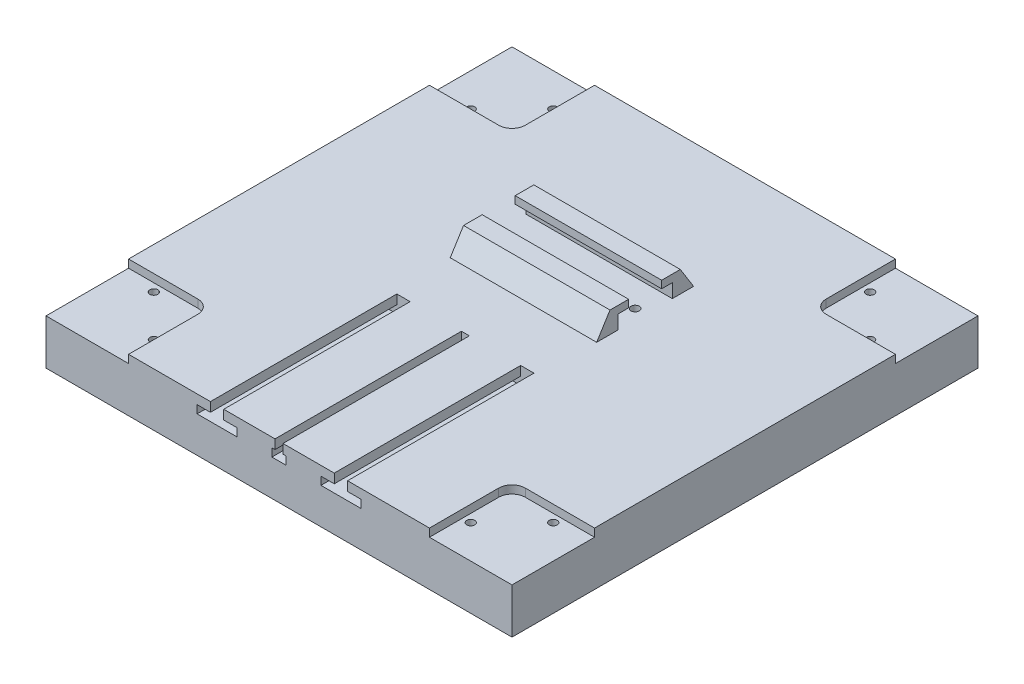
from build123d import *

# Parameters (mm, degrees)
SKETCH1_W           = 175
SKETCH1_H           = 175
BOSS_EXTRUDE2_DEPTH = 20
CUT_EXTRUDE6_DEPTH  = 3
CUT_EXTRUDE7_REACH  = 126.906
SKETCH8_R           = 1.5
CUT_EXTRUDE8_DEPTH  = 70
CUT_EXTRUDE9_REACH  = 127.35
SKETCH10_R          = 1.55
BOSS_EXTRUDE4_START = 8
SKETCH11_W          = 55
SKETCH11_H          = 26.4
SKETCH11_R          = 1.55
BOSS_EXTRUDE4_DEPTH = 8
CUT_EXTRUDE10_REACH = 149.191
SKETCH14_W          = 20.4
SKETCH14_H          = 5.2
CUT_EXTRUDE11_REACH = 149.191
SKETCH15_W          = 12.4
SKETCH15_H          = 2.8
BOSS_EXTRUDE7_DEPTH = 55
BOSS_EXTRUDE8_DEPTH = 55


with BuildPart() as part:
    # Sketch1 → Boss-Extrude2 (new body)
    with BuildSketch(Plane(origin=(0, 0, 0), x_dir=(1, 0, 0), z_dir=(0, 1, 0))):
        Rectangle(SKETCH1_W, SKETCH1_H)
    extrude(amount=BOSS_EXTRUDE2_DEPTH)

    # Sketch7 → Cut-Extrude6 (cut)
    with BuildSketch(Plane(origin=(0, 20, 0), x_dir=(1, 0, 0), z_dir=(0, 1, 0))):
        with BuildLine():
            Line((-87.5, 87.5), (-56.5, 87.5))
            Line((-56.5, 87.5), (-56.5, 61.5))
            ThreePointArc((-56.5, 61.5), (-57.964466094, 57.964466094), (-61.5, 56.5))
            Line((-61.5, 56.5), (-87.5, 56.5))
            Line((-87.5, 56.5), (-87.5, 87.5))
        make_face()
        with BuildLine():
            Line((87.5, 56.5), (61.5, 56.5))
            ThreePointArc((61.5, 56.5), (57.964466094, 57.964466094), (56.5, 61.5))
            Line((56.5, 61.5), (56.5, 87.5))
            Line((56.5, 87.5), (87.5, 87.5))
            Line((87.5, 87.5), (87.5, 56.5))
        make_face()
        with BuildLine():
            Line((87.5, -87.5), (87.5, -56.5))
            Line((87.5, -56.5), (61.5, -56.5))
            ThreePointArc((61.5, -56.5), (57.964466094, -57.964466094), (56.5, -61.5))
            Line((56.5, -61.5), (56.5, -87.5))
            Line((56.5, -87.5), (87.5, -87.5))
        make_face()
        with BuildLine():
            Line((-56.5, -87.5), (-56.5, -61.5))
            ThreePointArc((-56.5, -61.5), (-57.964466094, -57.964466094), (-61.5, -56.5))
            Line((-61.5, -56.5), (-87.5, -56.5))
            Line((-87.5, -56.5), (-87.5, -87.5))
            Line((-87.5, -87.5), (-56.5, -87.5))
        make_face()
    extrude(amount=-CUT_EXTRUDE6_DEPTH, mode=Mode.SUBTRACT)

    # Sketch8 → Cut-Extrude7 (cut, up to next)
    with BuildSketch(Plane(origin=(0, 17, 0), x_dir=(1, 0, 0), z_dir=(0, 1, 0)), mode=Mode.PRIVATE) as cut_extrude7_sk1:
        with Locations((-75, -59.5)):
            Circle(SKETCH8_R)
    cut_extrude7_tool1 = extrude(cut_extrude7_sk1.sketch, amount=-CUT_EXTRUDE7_REACH, mode=Mode.PRIVATE) & part.part
    # Sketch8 → Cut-Extrude7 (cut, up to next)
    with BuildSketch(Plane(origin=(0, 17, 0), x_dir=(1, 0, 0), z_dir=(0, 1, 0)), mode=Mode.PRIVATE) as cut_extrude7_sk2:
        with Locations((-59.5, -75)):
            Circle(SKETCH8_R)
    cut_extrude7_tool2 = extrude(cut_extrude7_sk2.sketch, amount=-CUT_EXTRUDE7_REACH, mode=Mode.PRIVATE) & part.part
    # Sketch8 → Cut-Extrude7 (cut, up to next)
    with BuildSketch(Plane(origin=(0, 17, 0), x_dir=(1, 0, 0), z_dir=(0, 1, 0)), mode=Mode.PRIVATE) as cut_extrude7_sk3:
        with Locations((59.5, -75)):
            Circle(SKETCH8_R)
    cut_extrude7_tool3 = extrude(cut_extrude7_sk3.sketch, amount=-CUT_EXTRUDE7_REACH, mode=Mode.PRIVATE) & part.part
    # Sketch8 → Cut-Extrude7 (cut, up to next)
    with BuildSketch(Plane(origin=(0, 17, 0), x_dir=(1, 0, 0), z_dir=(0, 1, 0)), mode=Mode.PRIVATE) as cut_extrude7_sk4:
        with Locations((75, -59.5)):
            Circle(SKETCH8_R)
    cut_extrude7_tool4 = extrude(cut_extrude7_sk4.sketch, amount=-CUT_EXTRUDE7_REACH, mode=Mode.PRIVATE) & part.part
    # Sketch8 → Cut-Extrude7 (cut, up to next)
    with BuildSketch(Plane(origin=(0, 17, 0), x_dir=(1, 0, 0), z_dir=(0, 1, 0)), mode=Mode.PRIVATE) as cut_extrude7_sk5:
        with Locations((59.5, 75)):
            Circle(SKETCH8_R)
    cut_extrude7_tool5 = extrude(cut_extrude7_sk5.sketch, amount=-CUT_EXTRUDE7_REACH, mode=Mode.PRIVATE) & part.part
    # Sketch8 → Cut-Extrude7 (cut, up to next)
    with BuildSketch(Plane(origin=(0, 17, 0), x_dir=(1, 0, 0), z_dir=(0, 1, 0)), mode=Mode.PRIVATE) as cut_extrude7_sk6:
        with Locations((75, 59.5)):
            Circle(SKETCH8_R)
    cut_extrude7_tool6 = extrude(cut_extrude7_sk6.sketch, amount=-CUT_EXTRUDE7_REACH, mode=Mode.PRIVATE) & part.part
    # Sketch8 → Cut-Extrude7 (cut, up to next)
    with BuildSketch(Plane(origin=(0, 17, 0), x_dir=(1, 0, 0), z_dir=(0, 1, 0)), mode=Mode.PRIVATE) as cut_extrude7_sk7:
        with Locations((-59.5, 75)):
            Circle(SKETCH8_R)
    cut_extrude7_tool7 = extrude(cut_extrude7_sk7.sketch, amount=-CUT_EXTRUDE7_REACH, mode=Mode.PRIVATE) & part.part
    # Sketch8 → Cut-Extrude7 (cut, up to next)
    with BuildSketch(Plane(origin=(0, 17, 0), x_dir=(1, 0, 0), z_dir=(0, 1, 0)), mode=Mode.PRIVATE) as cut_extrude7_sk8:
        with Locations((-75, 59.5)):
            Circle(SKETCH8_R)
    cut_extrude7_tool8 = extrude(cut_extrude7_sk8.sketch, amount=-CUT_EXTRUDE7_REACH, mode=Mode.PRIVATE) & part.part
    add(cut_extrude7_tool1.solids().sort_by_distance((-75, 17, 59.5))[0], mode=Mode.SUBTRACT)
    add(cut_extrude7_tool2.solids().sort_by_distance((-59.5, 17, 75))[0], mode=Mode.SUBTRACT)
    add(cut_extrude7_tool3.solids().sort_by_distance((59.5, 17, 75))[0], mode=Mode.SUBTRACT)
    add(cut_extrude7_tool4.solids().sort_by_distance((75, 17, 59.5))[0], mode=Mode.SUBTRACT)
    add(cut_extrude7_tool5.solids().sort_by_distance((59.5, 17, -75))[0], mode=Mode.SUBTRACT)
    add(cut_extrude7_tool6.solids().sort_by_distance((75, 17, -59.5))[0], mode=Mode.SUBTRACT)
    add(cut_extrude7_tool7.solids().sort_by_distance((-59.5, 17, -75))[0], mode=Mode.SUBTRACT)
    add(cut_extrude7_tool8.solids().sort_by_distance((-75, 17, -59.5))[0], mode=Mode.SUBTRACT)

    # Sketch9 → Cut-Extrude8 (cut)
    with BuildSketch(Plane.XY.offset(87.5)):
        Polygon((-20.75, 20), (-25.75, 20), (-25.75, 16.5), (-30.75, 16.5), (-30.75, 13.5), (-15.75, 13.5), (-15.75, 16.5), (-20.75, 16.5), align=None)
        Polygon((1.5, 20), (-1.5, 20), (-1.5, 16.5), (-2.65, 16.5), (-2.65, 13.5), (2.65, 13.5), (2.65, 16.5), (1.5, 16.5), align=None)
        Polygon((25.75, 16.5), (25.75, 20), (20.75, 20), (20.75, 16.5), (15.75, 16.5), (15.75, 13.5), (30.75, 13.5), (30.75, 16.5), align=None)
    extrude(amount=-CUT_EXTRUDE8_DEPTH, mode=Mode.SUBTRACT)

    # Sketch10 → Cut-Extrude9 (cut, up to next)
    with BuildSketch(Plane(origin=(0, 20, 0), x_dir=(1, 0, 0), z_dir=(0, 1, 0)), mode=Mode.PRIVATE) as cut_extrude9_sk1:
        with Locations((-23.75, 22.5)):
            Circle(SKETCH10_R)
    cut_extrude9_tool1 = extrude(cut_extrude9_sk1.sketch, amount=-CUT_EXTRUDE9_REACH, mode=Mode.PRIVATE) & part.part
    # Sketch10 → Cut-Extrude9 (cut, up to next)
    with BuildSketch(Plane(origin=(0, 20, 0), x_dir=(1, 0, 0), z_dir=(0, 1, 0)), mode=Mode.PRIVATE) as cut_extrude9_sk2:
        with Locations((23.75, 22.5)):
            Circle(SKETCH10_R)
    cut_extrude9_tool2 = extrude(cut_extrude9_sk2.sketch, amount=-CUT_EXTRUDE9_REACH, mode=Mode.PRIVATE) & part.part
    add(cut_extrude9_tool1.solids().sort_by_distance((-23.75, 20, -22.5))[0], mode=Mode.SUBTRACT)
    add(cut_extrude9_tool2.solids().sort_by_distance((23.75, 20, -22.5))[0], mode=Mode.SUBTRACT)

    # Sketch11 → Boss-Extrude4 (add)
    with BuildSketch(Plane(origin=(0, 20, 0), x_dir=(1, 0, 0), z_dir=(0, 1, 0)).offset(BOSS_EXTRUDE4_START)):
        with Locations((0, 22.5)):
            Rectangle(SKETCH11_W, SKETCH11_H)
        with Locations((-23.75, 22.5)):
            Circle(SKETCH11_R, mode=Mode.SUBTRACT)
        with Locations((23.75, 22.5)):
            Circle(SKETCH11_R, mode=Mode.SUBTRACT)
    extrude(amount=-BOSS_EXTRUDE4_DEPTH)

    # Sketch14 → Cut-Extrude10 (cut, up to next)
    with BuildSketch(Plane(origin=(27.5, 0, 0), x_dir=(0, 0, -1), z_dir=(1, 0, 0)), mode=Mode.PRIVATE) as cut_extrude10_sk1:
        with Locations((22.5, 22.6)):
            Rectangle(SKETCH14_W, SKETCH14_H)
    cut_extrude10_tool1 = extrude(cut_extrude10_sk1.sketch, amount=-CUT_EXTRUDE10_REACH, mode=Mode.PRIVATE) & part.part
    add(cut_extrude10_tool1.solids().sort_by_distance((27.5, 22.6, -22.5))[0], mode=Mode.SUBTRACT)

    # Sketch15 → Cut-Extrude11 (cut, up to next)
    with BuildSketch(Plane(origin=(27.5, 0, 0), x_dir=(0, 0, -1), z_dir=(1, 0, 0)), mode=Mode.PRIVATE) as cut_extrude11_sk1:
        with Locations((22.5, 26.6)):
            Rectangle(SKETCH15_W, SKETCH15_H)
    cut_extrude11_tool1 = extrude(cut_extrude11_sk1.sketch, amount=-CUT_EXTRUDE11_REACH, mode=Mode.PRIVATE) & part.part
    add(cut_extrude11_tool1.solids().sort_by_distance((27.5, 26.6, -22.5))[0], mode=Mode.SUBTRACT)

    # Sketch17 → Boss-Extrude7 (add)
    with BuildSketch(Plane(origin=(27.5, 0, 0), x_dir=(0, 0, -1), z_dir=(1, 0, 0))):
        Polygon((9.3, 28), (4.3, 20), (9.3, 20), align=None)
    extrude(amount=-BOSS_EXTRUDE7_DEPTH)

    # Sketch18 → Boss-Extrude8 (add)
    with BuildSketch(Plane(origin=(27.5, 0, 0), x_dir=(0, 0, -1), z_dir=(1, 0, 0))):
        Polygon((40.7, 20), (35.7, 28), (35.7, 20), align=None)
    extrude(amount=-BOSS_EXTRUDE8_DEPTH)


solid = part.part
